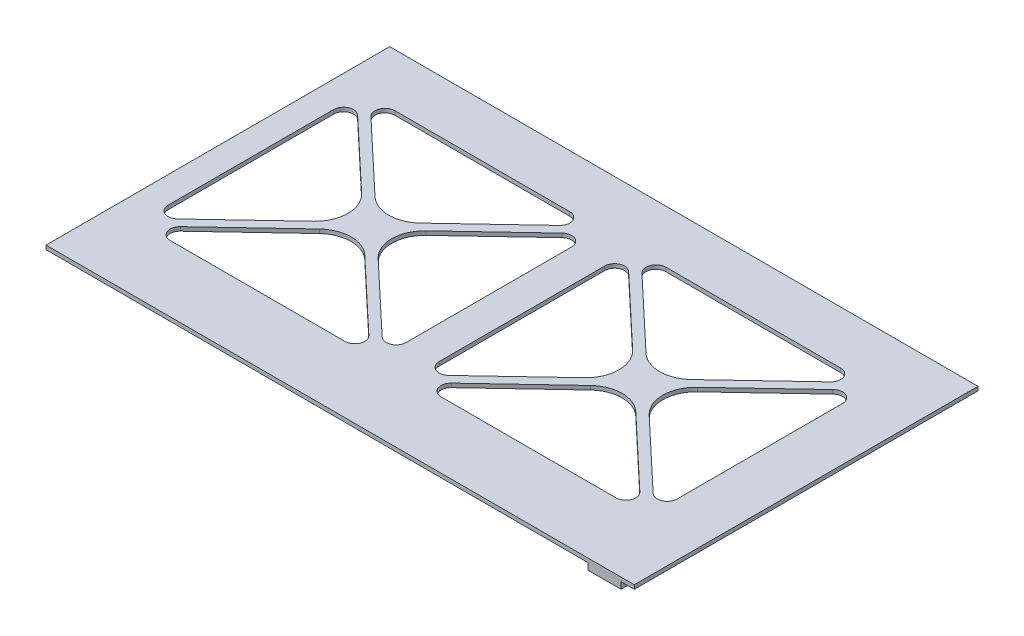
from build123d import *

# Parameters (mm, degrees)
SKETCH1_W           = 178
SKETCH1_H           = 104
SKETCH1_W_2         = 72
SKETCH1_H_2         = 68
BOSS_EXTRUDE1_DEPTH = 1.2
BOSS_EXTRUDE2_DEPTH = 5
SKETCH3_W           = 112
SKETCH3_H           = 10
BOSS_EXTRUDE3_DEPTH = 0.8
SKETCH4_W           = 10
SKETCH4_H           = 10
BOSS_EXTRUDE4_DEPTH = 2.8
SKETCH5_W           = 6
SKETCH5_H           = 2
CUT_EXTRUDE1_DEPTH  = 10
SKETCH6_W           = 10
SKETCH6_H           = 7.8
BOSS_EXTRUDE5_DEPTH = 6
FILLET1_R           = 10
FILLET2_R           = 6
SKETCH7_R           = 1.5
CUT_EXTRUDE2_DEPTH  = 4
FILLET3_R           = 3
SKETCH8_W           = 3
SKETCH8_H           = 10
BOSS_EXTRUDE6_DEPTH = 2.8
FILLET4_R           = 3
SKETCH9_W           = 10
SKETCH9_H           = 78
BOSS_EXTRUDE7_DEPTH = 2
BOSS_EXTRUDE8_DEPTH = 1.2


with BuildPart() as part:
    # Sketch1 → Boss-Extrude1 (new body)
    with BuildSketch(Plane(origin=(0, 0, 0), x_dir=(1, 0, 0), z_dir=(0, 1, 0))):
        with Locations((89, 52)):
            Rectangle(SKETCH1_W, SKETCH1_H)
        with Locations((126, 54)):
            Rectangle(SKETCH1_W_2, SKETCH1_H_2, mode=Mode.SUBTRACT)
        with Locations((44, 54)):
            Rectangle(SKETCH1_W_2, SKETCH1_H_2, mode=Mode.SUBTRACT)
    extrude(amount=BOSS_EXTRUDE1_DEPTH)

    # Sketch2 → Boss-Extrude2 (add)
    with BuildSketch(Plane(origin=(0, 0, -104), x_dir=(-1, 0, 0), z_dir=(0, 0, -1))):
        Polygon((-151, 0), (-148, 0), (-148, -2), (-144, -2), (-144, 0), (-141, 0), (-141, -4), (-144, -4), (-148, -4), (-151, -4), align=None)
    boss_extrude2 = extrude(amount=-BOSS_EXTRUDE2_DEPTH)

    # Mirror1: Boss-Extrude2 across plane
    add(boss_extrude2.mirror(Plane.ZY.offset(-78.75)))

    # Sketch3 → Boss-Extrude3 (add)
    with BuildSketch(Plane.XZ):
        with Locations((66, -10.2)):
            Rectangle(SKETCH3_W, SKETCH3_H)
    extrude(amount=BOSS_EXTRUDE3_DEPTH)

    # Sketch4 → Boss-Extrude4 (add)
    with BuildSketch(Plane.XZ):
        with Locations((5, -10.2)):
            Rectangle(SKETCH4_W, SKETCH4_H)
    extrude(amount=BOSS_EXTRUDE4_DEPTH)

    # Sketch5 → Cut-Extrude1 (cut)
    with BuildSketch(Plane.ZY):
        with Locations((-10.2, -1)):
            Rectangle(SKETCH5_W, SKETCH5_H)
    extrude(amount=-CUT_EXTRUDE1_DEPTH, mode=Mode.SUBTRACT)

    # Sketch6 → Boss-Extrude5 (add)
    with BuildSketch(Plane(origin=(0, 0, -104), x_dir=(-1, 0, 0), z_dir=(0, 0, -1))):
        with Locations((-89.25, -3.9)):
            Rectangle(SKETCH6_W, SKETCH6_H)
    extrude(amount=-BOSS_EXTRUDE5_DEPTH)

    # Fillet1
    # the kernel refuses this fillet: 10 mm, written as the material it adds along each edge
    with BuildSketch(Plane(origin=(94.25, 0, -104), x_dir=(1, 0, 0), z_dir=(0, 0, 1))) as fillet1_piece_1:
        with BuildLine():
            CenterArc((9.754998719, -10), FILLET1_R, 90, 77.290967006)
            Line((0, -7.8), (0, 0))
            Line((0, 0), (9.754998719, 0))
        make_face()
    extrude(amount=6)
    with BuildSketch(Plane(origin=(84.25, 0, -104), x_dir=(-1, 0, 0), z_dir=(0, 0, 1))) as fillet1_piece_2:
        with BuildLine():
            CenterArc((9.754998719, 10), FILLET1_R, 192.709032994, 77.290967006)
            Line((0, 7.8), (0, 0))
            Line((0, 0), (9.754998719, 0))
        make_face()
    extrude(amount=6)

    # Fillet2
    fillet2_edges = [part.edges().sort_by_distance(p)[0] for p in [
        (94.25, -7.8, -101),
        (84.25, -7.8, -101),
    ]]
    fillet(fillet2_edges, radius=FILLET2_R)

    # Sketch7 → Cut-Extrude2 (cut)
    with BuildSketch(Plane(origin=(0, 0, -104), x_dir=(-1, 0, 0), z_dir=(0, 0, -1))):
        with Locations((-89.25, -3.3)):
            Circle(SKETCH7_R)
    extrude(amount=-CUT_EXTRUDE2_DEPTH, mode=Mode.SUBTRACT)

    # Fillet3
    fillet3_edges = [part.edges().sort_by_distance(p)[0] for p in [
        (79.432105696, -1.303736435, -98),
        (99.067894304, -1.303736435, -98),
        (89.25, -7.8, -98),
        (85.271734229, -7.017758139, -98),
        (93.228265771, -7.017758139, -98),
    ]]
    fillet(fillet3_edges, radius=FILLET3_R)

    # Sketch8 → Boss-Extrude6 (add)
    with BuildSketch(Plane.XZ):
        with Locations((123.5, -10.2)):
            Rectangle(SKETCH8_W, SKETCH8_H)
    extrude(amount=BOSS_EXTRUDE6_DEPTH)

    # Fillet4
    # the kernel refuses this fillet: 3 mm, written as the material it adds along each edge
    with BuildSketch(Plane(origin=(125, 0, -5.2), x_dir=(1, 0, 0), z_dir=(0, 0, -1))) as fillet4_piece_1:
        with BuildLine():
            CenterArc((2.993325909, 3), FILLET4_R, 183.822553729, 86.177446271)
            Line((0, 2.8), (-0.059866518, 2.796))
            ThreePointArc((-0.059866518, 2.796), (-0.06, 1.4), (-0.06, 0))
            Line((-0.06, 0), (0, -0.06))
            Line((0, -0.06), (2.993325909, -0.06))
            Line((2.993325909, -0.06), (2.993325909, 0))
        make_face()
    extrude(amount=10)

    # Sketch9 → Boss-Extrude7 (add)
    with BuildSketch(Plane.XZ):
        with Locations((169, -39)):
            Rectangle(SKETCH9_W, SKETCH9_H)
    extrude(amount=BOSS_EXTRUDE7_DEPTH)

    # Sketch10 → Boss-Extrude8 (add)
    with BuildSketch(Plane(origin=(0, 1.2, 0), x_dir=(1, 0, 0), z_dir=(0, 1, 0))):
        with BuildLine():
            Line((15.496875383, 82.817231781), (37.139871313, 62.410978476))
            ThreePointArc((37.139871313, 62.410978476), (44, 59.686872538), (50.860128687, 62.410978476))
            Line((50.860128687, 62.410978476), (72.503124617, 82.817231781))
            ThreePointArc((72.503124617, 82.817231781), (73.233302704, 86.107180054), (70.445086011, 88))
            Line((70.445086011, 88), (53.755491102, 88))
            Line((53.755491102, 88), (53.755491102, 92.773114393))
            Line((53.755491102, 92.773114393), (83.607486332, 92.773114393))
            Line((83.607486332, 92.773114393), (83.607486332, 57.500394296))
            Line((83.607486332, 57.500394296), (80, 57.500394296))
            Line((80, 57.500394296), (80, 79.048223953))
            ThreePointArc((80, 79.048223953), (78.188672407, 81.802685408), (74.941961394, 81.230992171))
            Line((74.941961394, 81.230992171), (53.777463399, 61.275894062))
            ThreePointArc((53.777463399, 61.275894062), (50.637592086, 54), (53.777463399, 46.724105938))
            Line((53.777463399, 46.724105938), (74.941961394, 26.769007829))
            ThreePointArc((74.941961394, 26.769007829), (78.188672407, 26.197314592), (80, 28.951776047))
            Line((80, 28.951776047), (80, 51.757328614))
            Line((80, 51.757328614), (83.607486332, 51.757328614))
            Line((83.607486332, 51.757328614), (83.607486332, 17.03280878))
            Line((83.607486332, 17.03280878), (48.474442735, 17.03280878))
            Line((48.474442735, 17.03280878), (48.474442735, 20))
            Line((48.474442735, 20), (70.445086011, 20))
            ThreePointArc((70.445086011, 20), (73.233302704, 21.892819946), (72.503124617, 25.182768219))
            Line((72.503124617, 25.182768219), (50.860128687, 45.589021524))
            ThreePointArc((50.860128687, 45.589021524), (44, 48.313127462), (37.139871313, 45.589021524))
            Line((37.139871313, 45.589021524), (15.496875383, 25.182768219))
            ThreePointArc((15.496875383, 25.182768219), (14.766697296, 21.892819946), (17.554913989, 20))
            Line((17.554913989, 20), (45.016619204, 20))
            Line((45.016619204, 20), (45.016619204, 17.03280878))
            Line((45.016619204, 17.03280878), (3.455124081, 17.03280878))
            Line((3.455124081, 17.03280878), (3.455124081, 51.757328614))
            Line((3.455124081, 51.757328614), (8, 51.757328614))
            Line((8, 51.757328614), (8, 28.951776047))
            ThreePointArc((8, 28.951776047), (9.811327593, 26.197314592), (13.058038606, 26.769007829))
            Line((13.058038606, 26.769007829), (34.222536601, 46.724105938))
            ThreePointArc((34.222536601, 46.724105938), (37.362407914, 54), (34.222536601, 61.275894062))
            Line((34.222536601, 61.275894062), (13.058038606, 81.230992171))
            ThreePointArc((13.058038606, 81.230992171), (9.811327593, 81.802685408), (8, 79.048223953))
            Line((8, 79.048223953), (8, 56.332794756))
            Line((8, 56.332794756), (3.455124081, 56.332794756))
            Line((3.455124081, 56.332794756), (3.455124081, 92.773114393))
            Line((3.455124081, 92.773114393), (41.529538769, 92.773114393))
            Line((41.529538769, 92.773114393), (41.529538769, 88))
            Line((41.529538769, 88), (17.554913989, 88))
            ThreePointArc((17.554913989, 88), (14.766697296, 86.107180054), (15.496875383, 82.817231781))
        make_face()
    boss_extrude8 = extrude(amount=-BOSS_EXTRUDE8_DEPTH)

    # Mirror2: Boss-Extrude8 across plane
    add(boss_extrude8.mirror(Plane(origin=(85, 0, 0), x_dir=(0, 0, 1), z_dir=(1, 0, 0))))


solid = part.part
